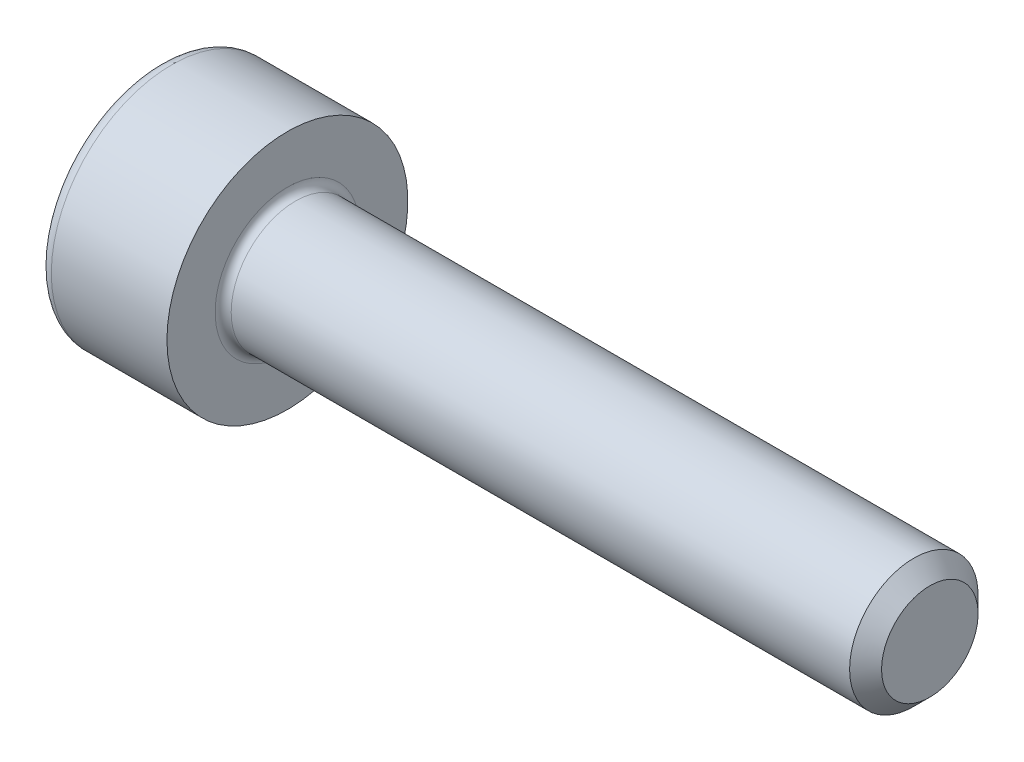
from build123d import *

# Parameters (mm, degrees)
FILLET1_R   = 0.1
FILLET2_R   = 0.16
HEX_2_DEPTH = 0.7


with BuildPart() as part:
    # BodySke → Base-Revolve (revolve)
    with BuildSketch(Plane.XY):
        Polygon((0, 0), (0, 1.5), (1.6, 1.5), (1.6, 0.8), (9.401, 0.8), (9.6, 0.601), (9.6, 0), align=None)
    revolve(axis=Axis((-31.75, 0, 0), (1, 0, 0)))

    # Fillet1
    fillet1_edges = [part.edges().sort_by_distance(p)[0] for p in [
        (1.6, -0.8, 0),
    ]]
    fillet(fillet1_edges, radius=FILLET1_R)

    # Fillet2
    fillet2_edges = [part.edges().sort_by_distance(p)[0] for p in [
        (0, -1.5, 0),
    ]]
    fillet(fillet2_edges, radius=FILLET2_R)

    # Sketch2 → Hex-PreBroach (revolve, cut)
    with BuildSketch(Plane.XY):
        Polygon((0, 0.76), (0.7, 0.76), (1.138786205, 0), (0, 0), align=None)
    revolve(axis=Axis((0, 0, 0), (1, 0, 0)), mode=Mode.SUBTRACT)

    # Sketch3 → Hex 2 (cut)
    with BuildSketch(Plane(origin=(0, 0, 0), x_dir=(0, 0.500000000000001, 0.866025403784438), z_dir=(-1, 0, 0))):
        Polygon((0.438786205, 0.76), (-0.438786205, 0.76), (-0.877572409, 0), (-0.438786205, -0.76), (0.438786205, -0.76), (0.877572409, 0), align=None)
    extrude(amount=-HEX_2_DEPTH, mode=Mode.SUBTRACT)


solid = part.part
